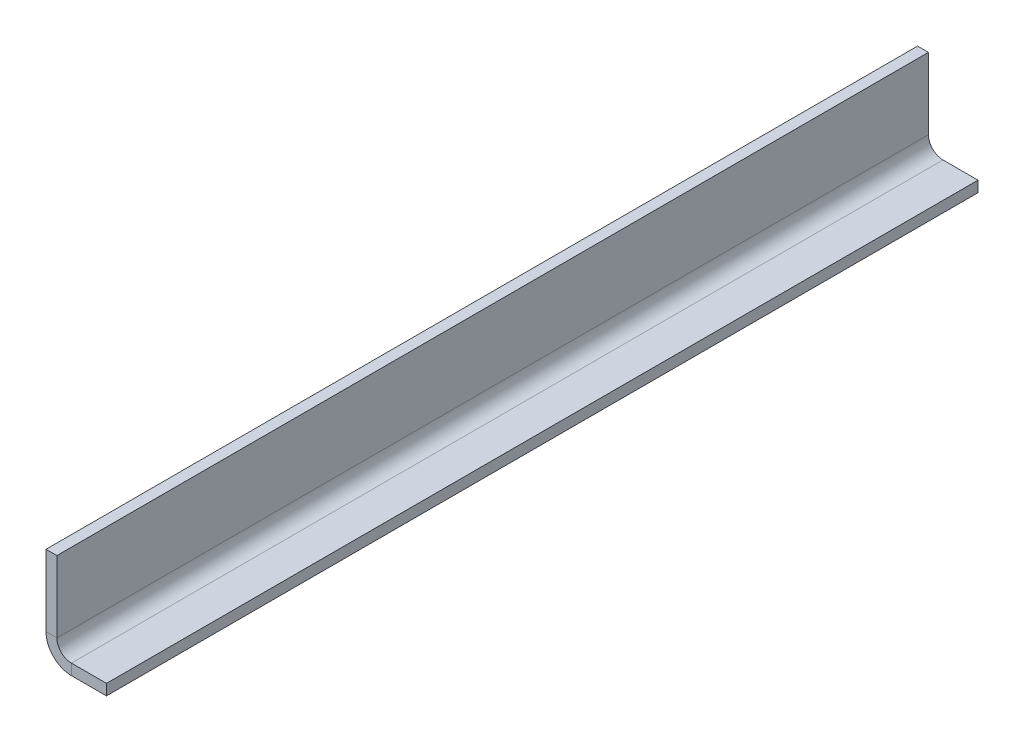
from build123d import *

# Parameters (mm, degrees)
BOSS_EXTRUDE1_DEPTH    = 120
CONVERT_SOLID1_DEPTH   = 120
CONVERT_SOLID1_2_DEPTH = 120


# Read off the part's stored shape, not the designer's step: Convert-Solid1
with BuildPart() as part:
    # Sketch1 → Boss-Extrude1 (new body)
    with BuildSketch(Plane.XY):
        Polygon((0, 15), (0, 0), (10, 0), (10, 3.175), (3.175, 3.175), (3.175, 15), align=None)
    extrude(amount=BOSS_EXTRUDE1_DEPTH)

    # Convert-Solid1 outline → Convert-Solid1 (cut)
    with BuildSketch(Plane.XY):
        with BuildLine():
            Line((1.675, 5.175), (1.675, 15))
            Line((1.675, 15), (0, 15))
            Line((0, 15), (0, 0))
            Line((0, 0), (10, 0))
            Line((10, 0), (10, 1.675))
            Line((10, 1.675), (5.175, 1.675))
            ThreePointArc((5.175, 1.675), (2.700126266, 2.700126266), (1.675, 5.175))
        make_face()
    extrude(amount=CONVERT_SOLID1_DEPTH, mode=Mode.SUBTRACT)

    # Convert-Solid1 2 outline → Convert-Solid1 2 (add)
    with BuildSketch(Plane.XY):
        with BuildLine():
            ThreePointArc((5.175, 3.175), (3.760786438, 3.760786438), (3.175, 5.175))
            Line((3.175, 5.175), (3.175, 3.175))
            Line((3.175, 3.175), (5.175, 3.175))
        make_face()
    extrude(amount=CONVERT_SOLID1_2_DEPTH)


solid = part.part
